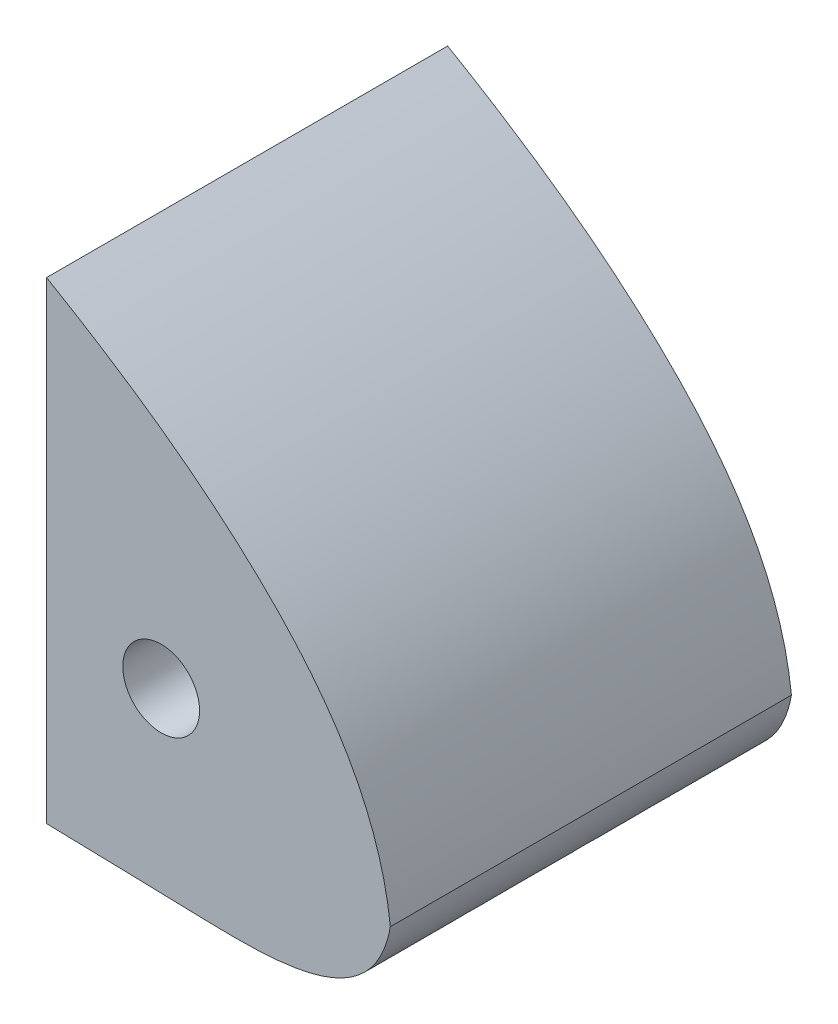
from build123d import *

# Parameters (mm, degrees)
SKETCH1_R           = 2.127
BOSS_EXTRUDE1_DEPTH = 22.225
SKETCH2_W           = 134.292636257
SKETCH2_H           = 53.36276468
CUT_EXTRUDE1_DEPTH  = 28.956


with BuildPart() as part:
    # Sketch1 → Boss-Extrude1 (new body)
    with BuildSketch(Plane.XY):
        with BuildLine():
            Line((-66.006971629, 14.952323969), (-66.006971629, -5.634708623))
            add(Edge.make_bspline(
                [(-66.006971629, -5.634708623), (-44.594037188, -5.53917688), (-13.013022308, -6.724098502), (26.136656569, -12.750856754), (48.765267423, -16.900764204), (64.683362663, -16.969052393), (75.290630493, -17.522529218), (76.216996263, -12.308293591)],
                knots=[0.133250972, 0.133250972, 0.133250972, 0.133250972, 0.517329722, 0.696666541, 0.849409938, 0.919519723, 1, 1, 1, 1], degree=3))
            add(Edge.make_bspline(
                [(76.216996263, -12.308293591), (75.606952539, -6.766559658), (69.704300689, 1.138389205), (56.422236631, 10.264383598), (36.976103105, 19.370772836), (8.741687209, 24.815403957), (-27.455234983, 23.566672909), (-52.387628688, 18.103631651), (-66.006971629, 14.952323969)],
                knots=[0, 0, 0, 0, 0.086586993, 0.161737428, 0.268322265, 0.445156627, 0.638028873, 0.872370876, 0.872370876, 0.872370876, 0.872370876], degree=3))
        make_face()
        with Locations((63.516996263, -7.228293591)):
            Circle(SKETCH1_R, mode=Mode.SUBTRACT)
        with Locations((-25.383003737, 13.091706409)):
            Circle(SKETCH1_R, mode=Mode.SUBTRACT)
    extrude(amount=BOSS_EXTRUDE1_DEPTH)

    # Sketch2 → Cut-Extrude1 (cut)
    with BuildSketch(Plane.XY.offset(22.225)):
        with Locations((-9.979321866, 4.011118028)):
            Rectangle(SKETCH2_W, SKETCH2_H)
    extrude(amount=-CUT_EXTRUDE1_DEPTH, mode=Mode.SUBTRACT)


solid = part.part
